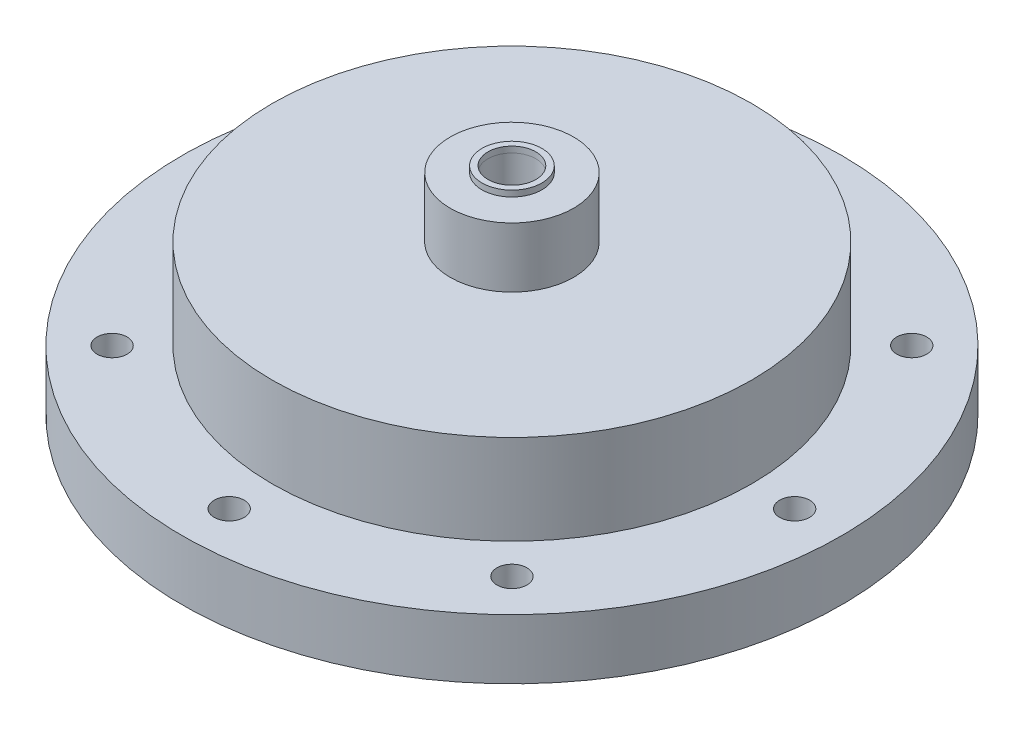
from build123d import *

# Parameters (mm, degrees)
SKETCH1_R           = 50.8
BOSS_EXTRUDE1_DEPTH = 31.75
SKETCH2_R           = 69.85
SKETCH2_R_2         = 50.8
BOSS_EXTRUDE2_DEPTH = 12.7
SKETCH3_R           = 49.53
SKETCH3_R_2         = 47.625
CUT_EXTRUDE1_DEPTH  = 1.1176
CUT_EXTRUDE2_REACH  = 105.76
SKETCH4_R           = 3.175
SKETCH5_R           = 6.35
CUT_EXTRUDE3_DEPTH  = 19.05
CUT_EXTRUDE4_REACH  = 102.603
SKETCH6_R           = 1.5875
CIRPATTERN2_COUNT   = 6
SKETCH34_R          = 13.081
SKETCH34_R_2        = 5.08
BOSS_EXTRUDE3_DEPTH = 12.7
SKETCH38_R          = 6.35
BOSS_EXTRUDE4_DEPTH = 1.27
CUT_EXTRUDE7_START  = -2.54
SKETCH39_R          = 5.08
CUT_EXTRUDE7_DEPTH  = 2.54


with BuildPart() as part:
    # Sketch1 → Boss-Extrude1 (new body)
    with BuildSketch(Plane(origin=(0, 0, 0), x_dir=(1, 0, 0), z_dir=(0, 1, 0))):
        with Locations(Location((0, 0, 0), (0, 0, 270))):
            Circle(SKETCH1_R)
    extrude(amount=BOSS_EXTRUDE1_DEPTH)

    # Sketch2 → Boss-Extrude2 (add)
    with BuildSketch(Plane.XZ):
        with Locations(Location((0, 0, 0), (0, 0, 270))):
            Circle(SKETCH2_R)
        with Locations(Location((0, 0, 0), (0, 0, 270))):
            Circle(SKETCH2_R_2, mode=Mode.SUBTRACT)
    extrude(amount=-BOSS_EXTRUDE2_DEPTH)

    # Sketch3 → Cut-Extrude1 (cut)
    with BuildSketch(Plane.XZ):
        with Locations(Location((0, 0, 0), (0, 0, 270))):
            Circle(SKETCH3_R)
        with Locations(Location((0, 0, 0), (0, 0, 270))):
            Circle(SKETCH3_R_2, mode=Mode.SUBTRACT)
    extrude(amount=-CUT_EXTRUDE1_DEPTH, mode=Mode.SUBTRACT)

    # Sketch4 → Cut-Extrude2 (cut, up to next)
    with BuildSketch(Plane.XZ, mode=Mode.PRIVATE) as cut_extrude2_sk1:
        with Locations(Location((0, -59.9186, 0), (0, 0, 270))):
            Circle(SKETCH4_R)
    cut_extrude2_tool1 = extrude(cut_extrude2_sk1.sketch, amount=-CUT_EXTRUDE2_REACH, mode=Mode.PRIVATE) & part.part
    # Sketch4 → Cut-Extrude2 (cut, up to next)
    with BuildSketch(Plane.XZ, mode=Mode.PRIVATE) as cut_extrude2_sk2:
        with Locations(Location((-42.368848379, -42.368848379, 0), (0, 0, 270))):
            Circle(SKETCH4_R)
    cut_extrude2_tool2 = extrude(cut_extrude2_sk2.sketch, amount=-CUT_EXTRUDE2_REACH, mode=Mode.PRIVATE) & part.part
    # Sketch4 → Cut-Extrude2 (cut, up to next)
    with BuildSketch(Plane.XZ, mode=Mode.PRIVATE) as cut_extrude2_sk3:
        with Locations(Location((-59.9186, 0, 0), (0, 0, 270))):
            Circle(SKETCH4_R)
    cut_extrude2_tool3 = extrude(cut_extrude2_sk3.sketch, amount=-CUT_EXTRUDE2_REACH, mode=Mode.PRIVATE) & part.part
    # Sketch4 → Cut-Extrude2 (cut, up to next)
    with BuildSketch(Plane.XZ, mode=Mode.PRIVATE) as cut_extrude2_sk4:
        with Locations(Location((-42.368848379, 42.368848379, 0), (0, 0, 270))):
            Circle(SKETCH4_R)
    cut_extrude2_tool4 = extrude(cut_extrude2_sk4.sketch, amount=-CUT_EXTRUDE2_REACH, mode=Mode.PRIVATE) & part.part
    # Sketch4 → Cut-Extrude2 (cut, up to next)
    with BuildSketch(Plane.XZ, mode=Mode.PRIVATE) as cut_extrude2_sk5:
        with Locations(Location((0, 59.9186, 0), (0, 0, 270))):
            Circle(SKETCH4_R)
    cut_extrude2_tool5 = extrude(cut_extrude2_sk5.sketch, amount=-CUT_EXTRUDE2_REACH, mode=Mode.PRIVATE) & part.part
    # Sketch4 → Cut-Extrude2 (cut, up to next)
    with BuildSketch(Plane.XZ, mode=Mode.PRIVATE) as cut_extrude2_sk6:
        with Locations(Location((42.368848379, 42.368848379, 0), (0, 0, 270))):
            Circle(SKETCH4_R)
    cut_extrude2_tool6 = extrude(cut_extrude2_sk6.sketch, amount=-CUT_EXTRUDE2_REACH, mode=Mode.PRIVATE) & part.part
    # Sketch4 → Cut-Extrude2 (cut, up to next)
    with BuildSketch(Plane.XZ, mode=Mode.PRIVATE) as cut_extrude2_sk7:
        with Locations(Location((59.9186, 0, 0), (0, 0, 270))):
            Circle(SKETCH4_R)
    cut_extrude2_tool7 = extrude(cut_extrude2_sk7.sketch, amount=-CUT_EXTRUDE2_REACH, mode=Mode.PRIVATE) & part.part
    # Sketch4 → Cut-Extrude2 (cut, up to next)
    with BuildSketch(Plane.XZ, mode=Mode.PRIVATE) as cut_extrude2_sk8:
        with Locations(Location((42.368848379, -42.368848379, 0), (0, 0, 270))):
            Circle(SKETCH4_R)
    cut_extrude2_tool8 = extrude(cut_extrude2_sk8.sketch, amount=-CUT_EXTRUDE2_REACH, mode=Mode.PRIVATE) & part.part
    add(cut_extrude2_tool1.solids().sort_by_distance((0, 0, -59.9186))[0], mode=Mode.SUBTRACT)
    add(cut_extrude2_tool2.solids().sort_by_distance((-42.368848, 0, -42.368848))[0], mode=Mode.SUBTRACT)
    add(cut_extrude2_tool3.solids().sort_by_distance((-59.9186, 0, 0))[0], mode=Mode.SUBTRACT)
    add(cut_extrude2_tool4.solids().sort_by_distance((-42.368848, 0, 42.368848))[0], mode=Mode.SUBTRACT)
    add(cut_extrude2_tool5.solids().sort_by_distance((0, 0, 59.9186))[0], mode=Mode.SUBTRACT)
    add(cut_extrude2_tool6.solids().sort_by_distance((42.368848, 0, 42.368848))[0], mode=Mode.SUBTRACT)
    add(cut_extrude2_tool7.solids().sort_by_distance((59.9186, 0, 0))[0], mode=Mode.SUBTRACT)
    add(cut_extrude2_tool8.solids().sort_by_distance((42.368848, 0, -42.368848))[0], mode=Mode.SUBTRACT)

    # Sketch5 → Cut-Extrude3 (cut)
    with BuildSketch(Plane(origin=(0, 31.75, 0), x_dir=(1, 0, 0), z_dir=(0, 1, 0))):
        with Locations(Location((0, 0, 0), (0, 0, 270))):
            Circle(SKETCH5_R)
    extrude(amount=-CUT_EXTRUDE3_DEPTH, mode=Mode.SUBTRACT)

    # Sketch6 → Cut-Extrude4 (cut, up to next)
    with BuildSketch(Plane(origin=(0, 12.7, 0), x_dir=(1, 0, 0), z_dir=(0, 1, 0)), mode=Mode.PRIVATE) as cut_extrude4_sk1:
        with Locations(Location((0, 0, 0), (0, 0, 270))):
            Circle(SKETCH6_R)
    cut_extrude4_tool1 = extrude(cut_extrude4_sk1.sketch, amount=-CUT_EXTRUDE4_REACH, mode=Mode.PRIVATE) & part.part
    add(cut_extrude4_tool1.solids().sort_by_distance((0, 12.7, 0))[0], mode=Mode.SUBTRACT)

    # Cut-Sweep8: read off the stored shape, not the designer's step
    # Cut-Sweep8: loft between two sections, ruled curve by curve
    cut_sweep8_from = [
        Edge.make_bspline([(0, 13.990935229, -6.31114181), (2.38125, 13.990935229, -6.31114181), (2.38125, 13.700001029, -3.947731381), (0, 13.700001029, -3.947731381), (-2.38125, 13.700001029, -3.947731381), (-2.38125, 13.990935229, -6.31114181), (0, 13.990935229, -6.31114181)], [0, 0, 0, 0, 0.5, 0.5, 0.5, 1, 1, 1, 1], 3, [1, 0.333333333, 0.333333333, 1, 0.333333333, 0.333333333, 1]),
    ]
    cut_sweep8_to = [
        Edge.make_bspline([(0, -48.271883257, 1.309904341), (2.38125, -48.271883257, 1.309904341), (2.38125, -48.562817457, 3.67331477), (0, -48.562817457, 3.67331477), (-2.38125, -48.562817457, 3.67331477), (-2.38125, -48.271883257, 1.309904341), (0, -48.271883257, 1.309904341)], [0, 0, 0, 0, 0.5, 0.5, 0.5, 1, 1, 1, 1], 3, [1, 0.333333333, 0.333333333, 1, 0.333333333, 0.333333333, 1]),
    ]
    cut_sweep8 = Solid(Shell([*[Face.make_surface_from_curves(cut_sweep8_from[k], cut_sweep8_to[k]) for k in range(1)], Face(Wire(cut_sweep8_from)), Face(Wire(cut_sweep8_to))]))
    add(cut_sweep8, mode=Mode.SUBTRACT)

    # Cut-Sweep8 2: loft between two sections, ruled curve by curve
    cut_sweep8_2_from = [
        Edge.make_bspline([(0, -48.575136164, 6.303833973), (2.38125, -48.575136164, 6.303833973), (2.38125, -48.575136164, 3.922583973), (0, -48.575136164, 3.922583973), (-2.38125, -48.575136164, 3.922583973), (-2.38125, -48.575136164, 6.303833973), (0, -48.575136164, 6.303833973)], [0, 0, 0, 0, 0.5, 0.5, 0.5, 1, 1, 1, 1], 3, [1, 0.333333333, 0.333333333, 1, 0.333333333, 0.333333333, 1]),
    ]
    cut_sweep8_2_to = [
        Edge.make_bspline([(0, 12.7, -8.969375), (2.38125, 12.7, -8.969375), (2.38125, 12.7, -11.350625), (0, 12.7, -11.350625), (-2.38125, 12.7, -11.350625), (-2.38125, 12.7, -8.969375), (0, 12.7, -8.969375)], [0, 0, 0, 0, 0.5, 0.5, 0.5, 1, 1, 1, 1], 3, [1, 0.333333333, 0.333333333, 1, 0.333333333, 0.333333333, 1]),
    ]
    cut_sweep8_2 = Solid(Shell([*[Face.make_surface_from_curves(cut_sweep8_2_from[k], cut_sweep8_2_to[k]) for k in range(1)], Face(Wire(cut_sweep8_2_from)), Face(Wire(cut_sweep8_2_to))]))
    add(cut_sweep8_2, mode=Mode.SUBTRACT)

    # CirPattern2: Cut-Sweep8, Cut-Sweep8 2 ×6 about axis
    cirpattern2_axis = Axis((0, -28.061269261, 0), (0, 1, 0))
    add([cut_sweep8.rotate(cirpattern2_axis, i * 360 / CIRPATTERN2_COUNT) for i in range(1, CIRPATTERN2_COUNT)], mode=Mode.SUBTRACT)
    add([cut_sweep8_2.rotate(cirpattern2_axis, i * 360 / CIRPATTERN2_COUNT) for i in range(1, CIRPATTERN2_COUNT)], mode=Mode.SUBTRACT)

    # Sketch34 → Boss-Extrude3 (add)
    with BuildSketch(Plane(origin=(0, 31.75, 0), x_dir=(1, 0, 0), z_dir=(0, 1, 0))):
        with Locations(Location((0, 0, 0), (0, 0, 270))):
            Circle(SKETCH34_R)
        with Locations(Location((0, 0, 0), (0, 0, 270))):
            Circle(SKETCH34_R_2, mode=Mode.SUBTRACT)
    extrude(amount=BOSS_EXTRUDE3_DEPTH)


with BuildPart() as body_2:
    # Sketch38 → Boss-Extrude4 (new body)
    with BuildSketch(Plane(origin=(0, 44.45, 0), x_dir=(1, 0, 0), z_dir=(0, 1, 0))):
        with Locations(Location((0, 0, 0), (0, 0, 270))):
            Circle(SKETCH38_R)
    extrude(amount=BOSS_EXTRUDE4_DEPTH)

    # Sketch39 → Cut-Extrude7 (cut)
    with BuildSketch(Plane(origin=(0, 45.72, 0), x_dir=(1, 0, 0), z_dir=(0, 1, 0)).offset(CUT_EXTRUDE7_START)):
        with Locations(Location((0, 0, 0), (0, 0, 270))):
            Circle(SKETCH39_R)
    extrude(amount=CUT_EXTRUDE7_DEPTH, mode=Mode.SUBTRACT)


solid = Compound([part.part, body_2.part])
